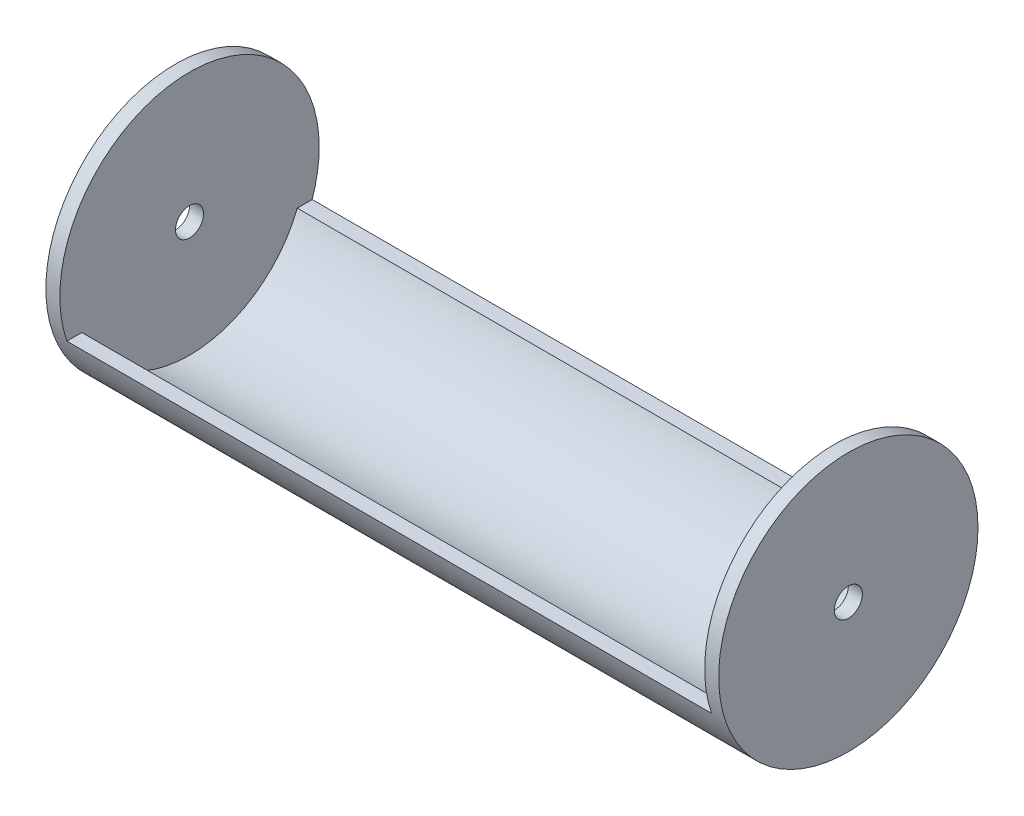
from build123d import *

# Parameters (mm, degrees)
SKETCH1_R               = 58.7375
SKETCH1_R_2             = 6.35
BOSS_EXTRUDE1_DEPTH     = 152.4
CUT_EXTRUDE1_DEPTH      = 174.568279972
CUT_EXTRUDE1_DEPTH_BACK = 174.568279972
SKETCH2_W               = 292.1
SKETCH2_H               = 77.7875
SHELL1_START            = -146.05
SHELL1_DEPTH            = 292.1


# Read off the part's stored shape, not the designer's step: Shell1
with BuildPart() as part:
    # Sketch1 → Boss-Extrude1 (new, symmetric)
    with BuildSketch(Plane(origin=(0, 0, 0), x_dir=(0, 0, -1), z_dir=(1, 0, 0))):
        with Locations(Location((0, 0, 0), (0, 0, 180))):
            Circle(SKETCH1_R)
        with Locations(Location((0, 0, 0), (0, 0, 180))):
            Circle(SKETCH1_R_2, mode=Mode.SUBTRACT)
    extrude(amount=BOSS_EXTRUDE1_DEPTH, both=True)

    # Sketch2 → Cut-Extrude1 (cut, two sides: drawn at the far end of the back side and taken through both)
    with BuildSketch(Plane.XY.offset(-CUT_EXTRUDE1_DEPTH_BACK)):
        with Locations((0, 19.84375)):
            Rectangle(SKETCH2_W, SKETCH2_H)
    extrude(amount=CUT_EXTRUDE1_DEPTH + CUT_EXTRUDE1_DEPTH_BACK, mode=Mode.SUBTRACT)

    # Shell1 outline → Shell1 (cut)
    with BuildSketch(Plane.YZ.offset(SHELL1_START)):
        with BuildLine():
            ThreePointArc((-19.05, 48.801103023), (-52.3875, 0), (-19.05, -48.801103023))
            Line((-19.05, -48.801103023), (-19.05, 48.801103023))
        make_face()
    extrude(amount=SHELL1_DEPTH, mode=Mode.SUBTRACT)


solid = part.part
